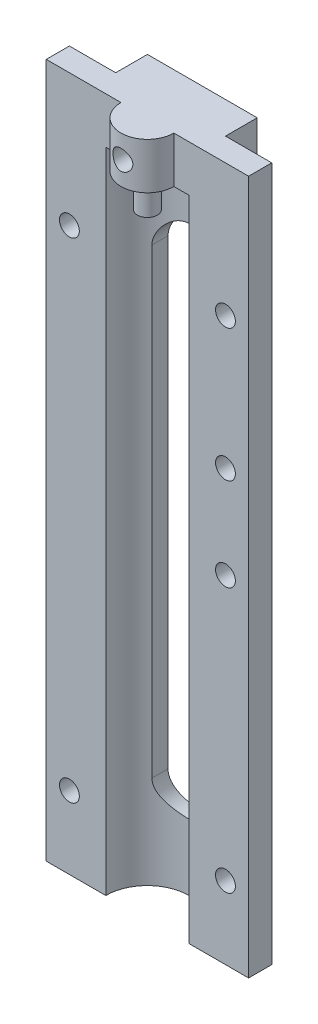
from build123d import *

# Parameters (mm, degrees)
SKETCH1_R                = 8.3
SKETCH1_R_2              = 6.3
BOSS_EXTRUDE1_DEPTH      = 95
SKETCH3_R                = 8.3
BOSS_EXTRUDE2_DEPTH      = 3
SKETCH5_W                = 16.6
SKETCH5_H                = 16.6
BOSS_EXTRUDE4_DEPTH      = 7
CUT_EXTRUDE1_DEPTH       = 107.627623063
FILLET1_R                = 4.1
SKETCH4_R                = 6.3
SKETCH4_R_2              = 1.5
CUT_EXTRUDE3_DEPTH       = 3
BOSS_EXTRUDE6_START      = 2
SKETCH8_R                = 1.5
BOSS_EXTRUDE6_DEPTH      = 2
BOSS_EXTRUDE7_START      = -0.774045
BOSS_EXTRUDE7_DEPTH      = 7.774045
F_3_0_3_DIAMETER_HOLE1_D = 3
F_3_0_3_DIAMETER_HOLE2_D = 3
F_3_0_3_DIAMETER_HOLE3_D = 3
CUT_EXTRUDE4_DEPTH       = 107.432983617


with BuildPart() as part:
    # Sketch1 → Boss-Extrude1 (new body)
    with BuildSketch(Plane(origin=(0, 0, 0), x_dir=(1, 0, 0), z_dir=(0, 1, 0))):
        with Locations(Location((0, 0, 0), (0, 0, 270))):
            Circle(SKETCH1_R)
        with Locations(Location((0, 0, 0), (0, 0, 270))):
            Circle(SKETCH1_R_2, mode=Mode.SUBTRACT)
    extrude(amount=BOSS_EXTRUDE1_DEPTH)

    # Sketch3 → Boss-Extrude2 (add)
    with BuildSketch(Plane(origin=(0, 95, 0), x_dir=(1, 0, 0), z_dir=(0, 1, 0))):
        with Locations(Location((0, 0, 0), (0, 0, 270))):
            Circle(SKETCH3_R)
    extrude(amount=BOSS_EXTRUDE2_DEPTH)

    # Sketch5 → Boss-Extrude4 (add)
    with BuildSketch(Plane(origin=(0, 98, 0), x_dir=(1, 0, 0), z_dir=(0, 1, 0))):
        Rectangle(SKETCH5_W, SKETCH5_H)
    extrude(amount=BOSS_EXTRUDE4_DEPTH)

    # Sketch6 → Cut-Extrude1 (cut, through all)
    with BuildSketch(Plane.XY.offset(8.3)):
        Polygon((4.1, 10), (0, 10), (-4.1, 10), (-4.1, 88), (4.1, 88), align=None)
    extrude(amount=-CUT_EXTRUDE1_DEPTH, mode=Mode.SUBTRACT)

    # Fillet1
    fillet1_edges = [part.edges().sort_by_distance(p)[0] for p in [
        (4.1, 88, 5.999975859),
        (4.1, 88, -5.999975859),
        (-4.1, 88, 5.999975859),
        (-4.1, 88, -5.999975859),
        (4.1, 10, -5.999975859),
        (4.1, 10, 5.999975859),
        (-4.1, 10, -5.999975859),
        (-4.1, 10, 5.999975859),
    ]]
    fillet(fillet1_edges, radius=FILLET1_R - 0.0001)  # a hair under: the kernel refuses the full size

    # Sketch4 → Cut-Extrude3 (cut)
    with BuildSketch(Plane(origin=(0, 95, 0), x_dir=(-1, 0, 0), z_dir=(0, -1, 0))):
        with Locations(Location((0, 0, 0), (0, 0, 90))):
            Circle(SKETCH4_R)
        with Locations(Location((0, 0, 0), (0, 0, 90))):
            Circle(SKETCH4_R_2, mode=Mode.SUBTRACT)
    extrude(amount=-CUT_EXTRUDE3_DEPTH, mode=Mode.SUBTRACT)

    # Sketch8 → Boss-Extrude6 (add)
    with BuildSketch(Plane(origin=(0, 95, 0), x_dir=(-1, 0, 0), z_dir=(0, -1, 0)).offset(BOSS_EXTRUDE6_START)):
        with Locations(Location((0, 0, 0), (0, 0, 90))):
            Circle(SKETCH8_R)
    extrude(amount=-BOSS_EXTRUDE6_DEPTH)

    # Sketch9 → Boss-Extrude7 (add)
    with BuildSketch(Plane.ZY.offset(8.3).offset(BOSS_EXTRUDE7_START)):
        Polygon((0, 0), (3.5, 0), (3.5, 105), (-3.5, 105), (-3.5, 0), align=None)
    boss_extrude7 = extrude(amount=BOSS_EXTRUDE7_DEPTH)

    # Mirror1: Boss-Extrude7 across plane
    add(boss_extrude7.mirror(Plane(origin=(0, 0, 0), x_dir=(0, 0, 1), z_dir=(1, 0, 0))))

    # Ø3.0 (3) Diameter Hole1 (through all)
    with Locations(Plane.XY.offset(8.3)):
        with Locations((0, 101.5)):
            Hole(F_3_0_3_DIAMETER_HOLE1_D / 2)

    # Ø3.0 (3) Diameter Hole2 (through all)
    with Locations(Plane.XY.offset(3.5)):
        with Locations((11.8, 85), (11.8, 11)):
            f_3_0_3_diameter_hole2 = Hole(F_3_0_3_DIAMETER_HOLE2_D / 2)

    # Ø3.0 (3) Diameter Hole3 (through all)
    with Locations(Plane(origin=(0, 0, -3.5), x_dir=(-1, 0, 0), z_dir=(0, 0, -1))):
        with Locations((-11.8, 65), (-11.8, 51)):
            Hole(F_3_0_3_DIAMETER_HOLE3_D / 2)

    # Mirror2: Ø3.0 (3) Diameter Hole2 across plane
    add(f_3_0_3_diameter_hole2.mirror(Plane(origin=(0, 0, 0), x_dir=(0, 0, 1), z_dir=(1, 0, 0))), mode=Mode.SUBTRACT)

    # Sketch17 → Cut-Extrude4 (cut, through all)
    with BuildSketch(Plane(origin=(0, 0, 0), x_dir=(-1, 0, 0), z_dir=(0, -1, 0))):
        with BuildLine():
            Line((15.3, -73.411355502), (15.3, 0))
            Line((15.3, 0), (15.3, 8.3))
            Line((15.3, 8.3), (-15.3, 8.3))
            Line((-15.3, 8.3), (-15.3, -8.3))
            Line((-15.3, -8.3), (15.3, -8.3))
            Line((15.3, -8.3), (15.3, 0))
            Line((15.3, 0), (4, 0))
            ThreePointArc((4, 0), (0, -4), (-4, 0))
            Line((-4, 0), (-15.3, 0))
            Line((-15.3, 0), (-88.711355502, 0))
            Line((-88.711355502, 0), (-173.375060896, -119.954013921))
            Line((-173.375060896, -119.954013921), (-69.363705394, -193.365369423))
            Line((-69.363705394, -193.365369423), (15.3, -73.411355502))
        make_face()
    extrude(amount=-CUT_EXTRUDE4_DEPTH, mode=Mode.SUBTRACT)


with BuildPart() as cut_extrude4_kept_piece:
    # of the separate pieces the step leaves, the one the design keeps (cut_extrude4_pieces_kept)
    add(part.part.solids().sort_by_distance((15.3, 0, -3.5))[0])


solid = cut_extrude4_kept_piece.part
